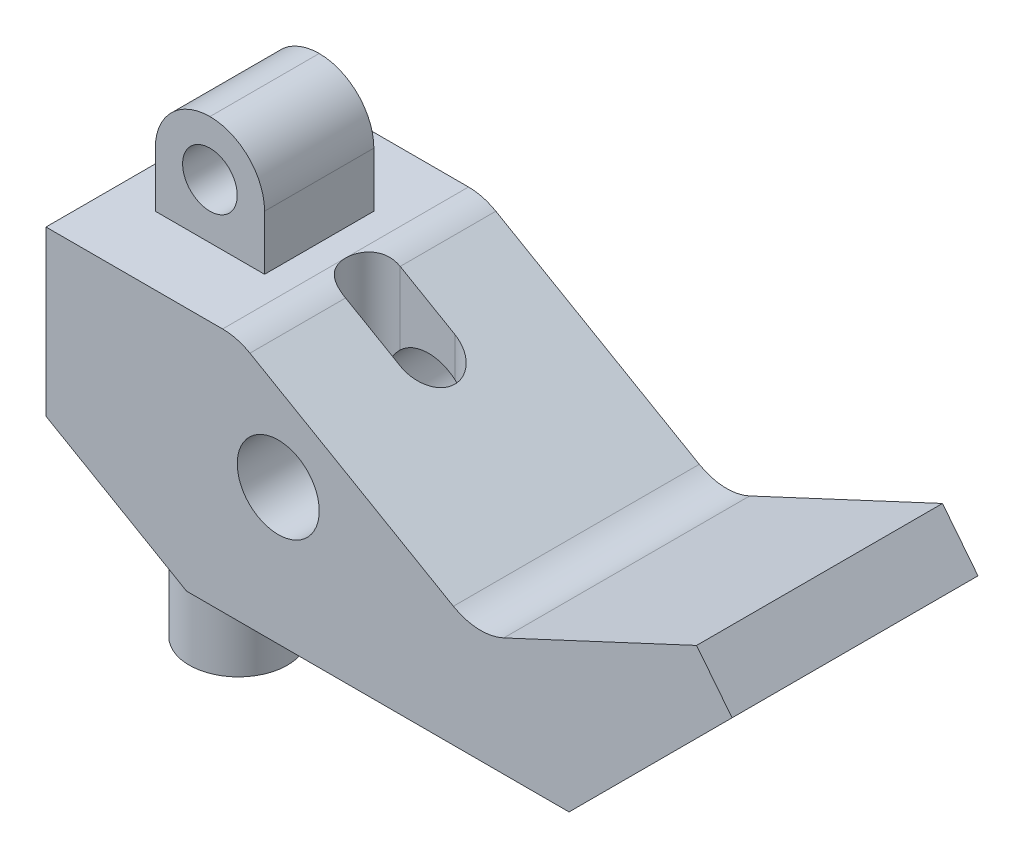
from build123d import *

# Parameters (mm, degrees)
BOSS_EXTRUDE1_DEPTH = 45
SKETCH2_W           = 20
SKETCH2_H           = 20
BOSS_EXTRUDE3_DEPTH = 20
FILLET2_R           = 10
FILLET3_R           = 10
SKETCH3_R           = 5
CUT_EXTRUDE1_DEPTH  = 20
SKETCH4_R           = 12.7
BOSS_EXTRUDE4_DEPTH = 14.849549065
SKETCH6_R           = 9
BOSS_EXTRUDE5_DEPTH = 25
CUT_EXTRUDE2_DEPTH  = 55
SKETCH8_R           = 7.5
CUT_EXTRUDE3_DEPTH  = 55


with BuildPart() as part:
    # Sketch1 → Boss-Extrude1 (new body)
    with BuildSketch(Plane.XY):
        with BuildLine():
            Line((0, 0), (70, 0))
            Line((70, 0), (99.838459525, 29.838459525))
            Line((99.838459525, 29.838459525), (93.338433206, 38.064606978))
            Line((93.338433206, 38.064606978), (58.056372922, 21.612312072))
            ThreePointArc((58.056372922, 21.612312072), (53.393996431, 20.684907727), (48.830190304, 22.015135905))
            Line((48.830190304, 22.015135905), (9.27982655, 44.849549065))
            Line((9.27982655, 44.849549065), (-25.72017345, 44.849549065))
            Line((-25.72017345, 44.849549065), (-25.72017345, 14.849549065))
            Line((-25.72017345, 14.849549065), (0, 0))
        make_face()
    extrude(amount=BOSS_EXTRUDE1_DEPTH)

    # Sketch2 → Boss-Extrude3 (add)
    with BuildSketch(Plane(origin=(0, 44.849549065, 0), x_dir=(1, 0, 0), z_dir=(0, 1, 0))):
        with Locations((-8.22017345, -22.5)):
            Rectangle(SKETCH2_W, SKETCH2_H)
    extrude(amount=BOSS_EXTRUDE3_DEPTH)

    # Fillet2
    fillet2_edges = [part.edges().sort_by_distance(p)[0] for p in [
        (1.77982655, 64.849549065, 22.5),
        (-18.22017345, 64.849549065, 22.5),
    ]]
    fillet(fillet2_edges, radius=FILLET2_R - 0.0001)  # a hair under: the kernel refuses the full size

    # Fillet3
    fillet3_edges = [part.edges().sort_by_distance(p)[0] for p in [
        (9.27982655, 44.849549065, 22.5),
    ]]
    fillet(fillet3_edges, radius=FILLET3_R)

    # Sketch3 → Cut-Extrude1 (cut)
    with BuildSketch(Plane.XY.offset(32.5)):
        with Locations((-8.22017345, 54.849549065)):
            Circle(SKETCH3_R)
    extrude(amount=-CUT_EXTRUDE1_DEPTH, mode=Mode.SUBTRACT)

    # Sketch4 → Boss-Extrude4 (add)
    with BuildSketch(Plane(origin=(0, 14.849549065, 0), x_dir=(1, 0, 0), z_dir=(0, 1, 0))):
        with Locations(Location((-13.02017345, -22.5, 0), (0, 0, 180))):
            Circle(SKETCH4_R)
    extrude(amount=-BOSS_EXTRUDE4_DEPTH)

    # Sketch6 → Boss-Extrude5 (add)
    with BuildSketch(Plane.XZ):
        with Locations(Location((-13.02017345, 22.5, 0), (0, 0, 270))):
            Circle(SKETCH6_R)
    extrude(amount=BOSS_EXTRUDE5_DEPTH)

    # Sketch7 → Cut-Extrude2 (cut)
    with BuildSketch(Plane(origin=(0, 44.849549065, 0), x_dir=(1, 0, 0), z_dir=(0, 1, 0))):
        with BuildLine():
            Line((11.600334626, -17.5), (21.600334626, -17.5))
            ThreePointArc((21.600334626, -17.5), (26.600334626, -22.5), (21.600334626, -27.5))
            Line((21.600334626, -27.5), (11.600334626, -27.5))
            ThreePointArc((11.600334626, -27.5), (6.600334626, -22.5), (11.600334626, -17.5))
        make_face()
    extrude(amount=-CUT_EXTRUDE2_DEPTH, mode=Mode.SUBTRACT)

    # Sketch8 → Cut-Extrude3 (cut)
    with BuildSketch(Plane.XY.offset(45)):
        with Locations((16.77982655, 24.849549065)):
            Circle(SKETCH8_R)
    extrude(amount=-CUT_EXTRUDE3_DEPTH, mode=Mode.SUBTRACT)


solid = part.part
